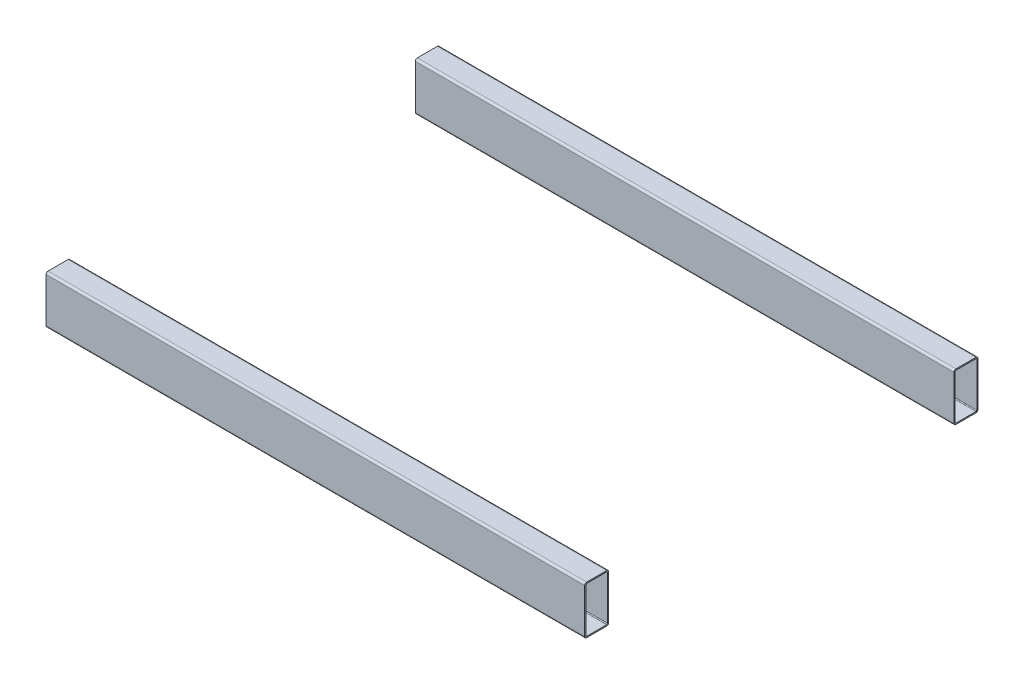
from build123d import *

# Parameters (mm, degrees)
SKETCH1_W           = 1342
SKETCH1_H           = 120
BOSS_EXTRUDE1_DEPTH = 60
SKETCH4_W           = 1342
SKETCH4_H           = 120
BOSS_EXTRUDE2_DEPTH = 60
FILLET2_R           = 5
FILLET3_R           = 5
SHELL1_START        = -668
SHELL1_DEPTH        = 1336
SHELL2_START        = -668
SHELL2_DEPTH        = 1336
CUT_EXTRUDE2_DEPTH  = 2156.634477364


# Read off the part's stored shape, not the designer's step: Shell1, Shell2
with BuildPart() as part:
    # Sketch1 → Boss-Extrude1 (new body)
    with BuildSketch(Plane.XY):
        with Locations((0, -1354)):
            Rectangle(SKETCH1_W, SKETCH1_H)
    extrude(amount=BOSS_EXTRUDE1_DEPTH)

    # Fillet3
    fillet3_edges = [part.edges().sort_by_distance(p)[0] for p in [
        (0, -1414, 60),
        (0, -1414, 0),
        (0, -1294, 0),
        (0, -1294, 60),
    ]]
    fillet(fillet3_edges, radius=FILLET3_R)

    # Shell1 outline → Shell1 (cut)
    with BuildSketch(Plane.YZ.offset(SHELL1_START)):
        with BuildLine():
            Line((-1297, 5), (-1297, 55))
            ThreePointArc((-1297, 55), (-1297.585786438, 56.414213562), (-1299, 57))
            Line((-1299, 57), (-1409, 57))
            ThreePointArc((-1409, 57), (-1410.414213562, 56.414213562), (-1411, 55))
            Line((-1411, 55), (-1411, 5))
            ThreePointArc((-1411, 5), (-1410.414213562, 3.585786438), (-1409, 3))
            Line((-1409, 3), (-1299, 3))
            ThreePointArc((-1299, 3), (-1297.585786438, 3.585786438), (-1297, 5))
        make_face()
    extrude(amount=SHELL1_DEPTH, mode=Mode.SUBTRACT)


with BuildPart() as body_2:
    # Sketch4 → Boss-Extrude2 (new body)
    with BuildSketch(Plane(origin=(0, 0, -860), x_dir=(-1, 0, 0), z_dir=(0, 0, -1))):
        with Locations((0, -1354)):
            Rectangle(SKETCH4_W, SKETCH4_H)
    extrude(amount=BOSS_EXTRUDE2_DEPTH)

    # Fillet2
    fillet2_edges = [body_2.edges().sort_by_distance(p)[0] for p in [
        (0, -1414, -920),
        (0, -1294, -920),
        (0, -1414, -860),
        (0, -1294, -860),
    ]]
    fillet(fillet2_edges, radius=FILLET2_R)

    # Shell2 outline → Shell2 (cut)
    with BuildSketch(Plane.YZ.offset(SHELL2_START)):
        with BuildLine():
            Line((-1297, -915), (-1297, -865))
            ThreePointArc((-1297, -865), (-1297.585786438, -863.585786438), (-1299, -863))
            Line((-1299, -863), (-1409, -863))
            ThreePointArc((-1409, -863), (-1410.414213562, -863.585786438), (-1411, -865))
            Line((-1411, -865), (-1411, -915))
            ThreePointArc((-1411, -915), (-1410.414213562, -916.414213562), (-1409, -917))
            Line((-1409, -917), (-1299, -917))
            ThreePointArc((-1299, -917), (-1297.585786438, -916.414213562), (-1297, -915))
        make_face()
    extrude(amount=SHELL2_DEPTH, mode=Mode.SUBTRACT)


with BuildPart() as cut_extrude2_tool:
    # Sketch3 → Cut-Extrude2 (new, through all)
    with BuildSketch(Plane.ZY.offset(671)):
        with BuildLine():
            Line((5, -1411), (55, -1411))
            ThreePointArc((55, -1411), (56.414213562, -1410.414213562), (57, -1409))
            Line((57, -1409), (57, -1299))
            ThreePointArc((57, -1299), (56.414213562, -1297.585786438), (55, -1297))
            Line((55, -1297), (5, -1297))
            ThreePointArc((5, -1297), (3.585786438, -1297.585786438), (3, -1299))
            Line((3, -1299), (3, -1409))
            ThreePointArc((3, -1409), (3.585786438, -1410.414213562), (5, -1411))
        make_face()
        with BuildLine():
            Line((-915, -1411), (-865, -1411))
            ThreePointArc((-865, -1411), (-863.585786438, -1410.414213562), (-863, -1409))
            Line((-863, -1409), (-863, -1299))
            ThreePointArc((-863, -1299), (-863.585786438, -1297.585786438), (-865, -1297))
            Line((-865, -1297), (-915, -1297))
            ThreePointArc((-915, -1297), (-916.414213562, -1297.585786438), (-917, -1299))
            Line((-917, -1299), (-917, -1409))
            ThreePointArc((-917, -1409), (-916.414213562, -1410.414213562), (-915, -1411))
        make_face()
    extrude(amount=-CUT_EXTRUDE2_DEPTH)


with BuildPart() as part_1:
    add(part.part)

    # Cut-Extrude2: cut by cut_extrude2_tool
    add(cut_extrude2_tool.part, mode=Mode.SUBTRACT)


with BuildPart() as body_2_1:
    add(body_2.part)

    # Cut-Extrude2: cut by cut_extrude2_tool
    add(cut_extrude2_tool.part, mode=Mode.SUBTRACT)


solid = Compound([part_1.part, body_2_1.part])
